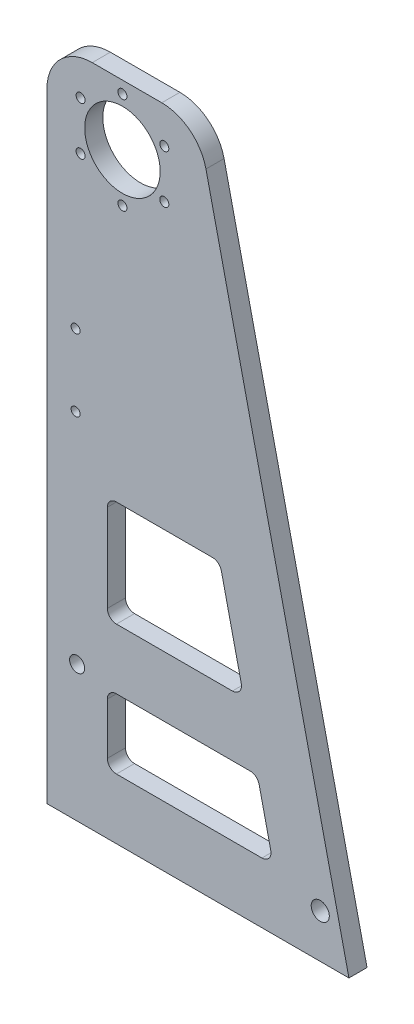
from build123d import *

# Parameters (mm, degrees)
ESBO_O1_R                = 12.5
ESBO_O1_R_2              = 1.5
ESBO_O1_R_3              = 2.5
RESSALTO_EXTRUS_O2_DEPTH = 6
FILETE1_R                = 15
ESBO_O2_R                = 3
ESBO_O2_RX               = 1.5
ESBO_O2_RY               = 1.426584774
CORTE_EXTRUS_O1_DEPTH    = 242.735392527


with BuildPart() as part:
    # Esboço1 → Ressalto-extrusão2 (new body)
    with BuildSketch(Plane.XY):
        Polygon((0, 0), (0, 220), (50, 220), (100, 0), align=None)
        with Locations((25, 200)):
            Circle(ESBO_O1_R, mode=Mode.SUBTRACT)
        with Locations((25, 216)):
            Circle(ESBO_O1_R_2, mode=Mode.SUBTRACT)
        with Locations((38.856406461, 208)):
            Circle(ESBO_O1_R_2, mode=Mode.SUBTRACT)
        with Locations((38.856406461, 192)):
            Circle(ESBO_O1_R_2, mode=Mode.SUBTRACT)
        with Locations((25, 184)):
            Circle(ESBO_O1_R_2, mode=Mode.SUBTRACT)
        with Locations((11.143593539, 192)):
            Circle(ESBO_O1_R_2, mode=Mode.SUBTRACT)
        with Locations((11.143593539, 208)):
            Circle(ESBO_O1_R_2, mode=Mode.SUBTRACT)
        with Locations((10, 45)):
            Circle(ESBO_O1_R_3, mode=Mode.SUBTRACT)
        with BuildLine():
            Line((20, 95), (20, 66))
            ThreePointArc((20, 66), (20.878679656, 63.878679656), (23, 63))
            Line((23, 63), (61.413470366, 63))
            ThreePointArc((61.413470366, 63), (63.75810146, 64.128448496), (64.338868934, 66.664863311))
            Line((64.338868934, 66.664863311), (57.747959843, 95.664863311))
            ThreePointArc((57.747959843, 95.664863311), (56.69411278, 97.344631094), (54.822561275, 98))
            Line((54.822561275, 98), (23, 98))
            ThreePointArc((23, 98), (20.878679656, 97.121320344), (20, 95))
        make_face(mode=Mode.SUBTRACT)
        with BuildLine():
            Line((20, 40), (20, 23))
            ThreePointArc((20, 23), (20.878679656, 20.878679656), (23, 20))
            Line((23, 20), (71.186197639, 20))
            ThreePointArc((71.186197639, 20), (73.530828733, 21.128448496), (74.111596206, 23.664863311))
            Line((74.111596206, 23.664863311), (70.247959843, 40.664863311))
            ThreePointArc((70.247959843, 40.664863311), (69.19411278, 42.344631094), (67.322561275, 43))
            Line((67.322561275, 43), (23, 43))
            ThreePointArc((23, 43), (20.878679656, 42.121320344), (20, 40))
        make_face(mode=Mode.SUBTRACT)
    extrude(amount=RESSALTO_EXTRUS_O2_DEPTH)

    # Filete1
    filete1_edges = [part.edges().sort_by_distance(p)[0] for p in [
        (0, 220, 3),
        (50, 220, 3),
    ]]
    fillet(filete1_edges, radius=FILETE1_R)

    # Esboço2 → Corte-extrusão1 (cut, through all)
    with BuildSketch(Plane.XY.offset(6)):
        with Locations((90.5, 14.5)):
            Circle(ESBO_O2_R)
        with Locations(Location((9.5, 117.202456767), (0, 0, 180))):
            Ellipse(ESBO_O2_RX, ESBO_O2_RY)
        with Locations(Location((9.5, 140.978869674), (0, 0, 180))):
            Ellipse(ESBO_O2_RX, ESBO_O2_RY)
    extrude(amount=-CORTE_EXTRUS_O1_DEPTH, mode=Mode.SUBTRACT)


solid = part.part
